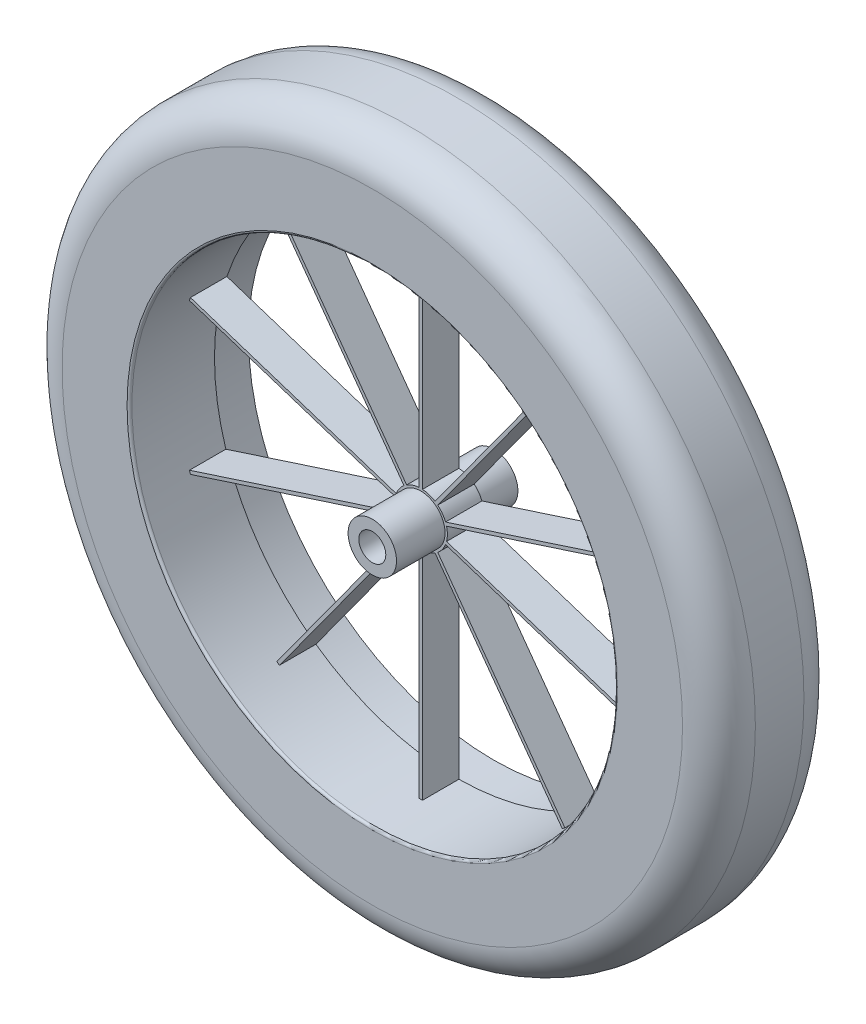
from build123d import *

# Parameters (mm, degrees)
CROQUIS1_R                   = 275
SALIENTE_EXTRUIR1_DEPTH      = 70
CROQUIS2_R                   = 200
CORTAR_EXTRUIR1_DEPTH        = 40
CROQUIS5_R                   = 10
CORTAR_EXTRUIR2_DEPTH        = 10
REDONDEO1_R                  = 2
CORTAR_EXTRUIR_L_MINA2_DEPTH = 396.15819617
MATRIZC1_COUNT               = 24
CORTAR_EXTRUIR3_DEPTH        = 150
SALIENTE_EXTRUIR2_DEPTH      = 50
SALIENTE_EXTRUIR2_DEPTH_BACK = 50
CROQUIS12_R                  = 19.934957438
CROQUIS14_R                  = 285.546784005
CROQUIS14_R_2                = 202
SALIENTE_EXTRUIR3_DEPTH      = 100
REDONDEO2_R                  = 30
REDONDEO3_R                  = 30
SCALE1_SCALE                 = 0.5
SCALE2_SCALE                 = 0.1
SCALE3_SCALE                 = 0.2
SCALE4_SCALE                 = 0.3
SCALE5_SCALE                 = 20
SCALE6_SCALE                 = 1.5
SKETCH1_R                    = 1
CUT_EXTRUDE1_DEPTH           = 5


with BuildPart() as part:
    # Croquis1 → Saliente-Extruir1 (new body)
    with BuildSketch(Plane.XY):
        Circle(CROQUIS1_R)
    extrude(amount=SALIENTE_EXTRUIR1_DEPTH)

    # Croquis2 → Cortar-Extruir1 (cut)
    with BuildSketch(Plane.XY.offset(70)):
        Circle(CROQUIS2_R)
    extrude(amount=-CORTAR_EXTRUIR1_DEPTH, mode=Mode.SUBTRACT)

    # Croquis5 → Cortar-Extruir2 (cut)
    with BuildSketch(Plane.XY.offset(30)):
        Circle(CROQUIS5_R)
    extrude(amount=-CORTAR_EXTRUIR2_DEPTH, mode=Mode.SUBTRACT)

    # Redondeo1
    redondeo1_edges = [part.edges().sort_by_distance(p)[0] for p in [
        (-200, 0, 70),
    ]]
    fillet(redondeo1_edges, radius=REDONDEO1_R)

    # Croquis6 → Cortar-Extruir-Lámina2 (cut, through all)
    with BuildSketch(Plane.XY.offset(70)):
        Polygon((-99.341458201, 256.429863086), (-89.226691548, 230.320640663), (-89.319938771, 230.284516496), (-99.434705424, 256.39373892), align=None)
    cortar_extruir_l_mina2 = extrude(amount=-CORTAR_EXTRUIR_L_MINA2_DEPTH, mode=Mode.SUBTRACT)

    # MatrizC1: Cortar-Extruir-Lámina2 ×24 about axis
    matrizc1_axis = Axis((0, 0, 20), (0, 0, 1))
    for i in range(1, MATRIZC1_COUNT):
        add(cortar_extruir_l_mina2.rotate(matrizc1_axis, i * 360 / MATRIZC1_COUNT), mode=Mode.SUBTRACT)

    # Croquis11 → Cortar-Extruir3 (cut)
    with BuildSketch(Plane.XY.offset(30)):
        with BuildLine():
            Line((20.326023118, 8.014133235), (189.792696605, 63.077193306))
            ThreePointArc((189.792696605, 63.077193306), (161.803398875, 117.557050458), (118.639144382, 161.011656163))
            Line((118.639144382, 161.011656163), (13.902980207, 16.854693372))
            ThreePointArc((13.902980207, 16.854693372), (17.676115044, 12.842449309), (20.326023118, 8.014133235))
        make_face()
        with BuildLine():
            ThreePointArc((190.621360943, -60.526826715), (200, 0), (190.621360943, 60.526826715))
            Line((190.621360943, 60.526826715), (21.154687456, 5.463766645))
            ThreePointArc((21.154687456, 5.463766645), (21.848879772, 0), (21.154687456, -5.463766645))
            Line((21.154687456, -5.463766644), (190.621360943, -60.526826715))
        make_face()
        with BuildLine():
            Line((11.733508805, 18.430906609), (116.469672981, 162.587869399))
            ThreePointArc((116.469672981, 162.587869399), (61.803398875, 190.211303259), (1.340807064, 199.995505541))
            Line((1.340807064, 199.995505541), (1.340807064, 21.807700102))
            ThreePointArc((1.340807064, 21.807700102), (6.751675158, 20.779519481), (11.733508805, 18.430906609))
        make_face()
        with BuildLine():
            ThreePointArc((118.639144382, -161.011656163), (161.803398875, -117.557050458), (189.792696605, -63.077193306))
            Line((189.792696605, -63.077193306), (20.326023118, -8.014133235))
            ThreePointArc((20.326023118, -8.014133235), (17.676115044, -12.842449309), (13.902980207, -16.854693372))
            Line((13.902980207, -16.854693372), (118.639144382, -161.011656163))
        make_face()
        with BuildLine():
            Line((-1.340807064, 21.807700102), (-1.340807064, 199.995505541))
            ThreePointArc((-1.340807064, 199.995505541), (-61.803398875, 190.211303259), (-116.469672981, 162.587869399))
            Line((-116.469672981, 162.587869399), (-11.733508805, 18.430906609))
            ThreePointArc((-11.733508805, 18.430906609), (-6.751675158, 20.779519481), (-1.340807064, 21.807700102))
        make_face()
        with BuildLine():
            ThreePointArc((1.340807064, -199.995505541), (61.803398875, -190.211303259), (116.469672981, -162.587869399))
            Line((116.469672981, -162.587869399), (11.733508805, -18.430906609))
            ThreePointArc((11.733508805, -18.430906609), (6.751675158, -20.779519481), (1.340807064, -21.807700102))
            Line((1.340807064, -21.807700102), (1.340807064, -199.995505541))
        make_face()
        with BuildLine():
            Line((-13.902980207, 16.854693372), (-118.639144382, 161.011656163))
            ThreePointArc((-118.639144382, 161.011656163), (-161.803398875, 117.557050458), (-189.792696605, 63.077193306))
            Line((-189.792696605, 63.077193306), (-20.326023118, 8.014133235))
            ThreePointArc((-20.326023118, 8.014133235), (-17.676115044, 12.842449309), (-13.902980207, 16.854693372))
        make_face()
        with BuildLine():
            ThreePointArc((-116.469672981, -162.587869399), (-61.803398875, -190.211303259), (-1.340807064, -199.995505541))
            Line((-1.340807064, -199.995505541), (-1.340807064, -21.807700102))
            ThreePointArc((-1.340807064, -21.807700102), (-6.751675158, -20.779519481), (-11.733508805, -18.430906609))
            Line((-11.733508805, -18.430906609), (-116.469672981, -162.587869399))
        make_face()
        with BuildLine():
            Line((-21.154687456, 5.463766645), (-190.621360943, 60.526826715))
            ThreePointArc((-190.621360943, 60.526826715), (-200, 0), (-190.621360943, -60.526826715))
            Line((-190.621360943, -60.526826715), (-21.154687456, -5.463766644))
            ThreePointArc((-21.154687456, -5.463766644), (-21.848879772, 0), (-21.154687456, 5.463766645))
        make_face()
        with BuildLine():
            ThreePointArc((-189.792696605, -63.077193306), (-161.803398875, -117.557050458), (-118.639144382, -161.011656163))
            Line((-118.639144382, -161.011656163), (-13.902980207, -16.854693372))
            ThreePointArc((-13.902980207, -16.854693372), (-17.676115044, -12.842449309), (-20.326023118, -8.014133235))
            Line((-20.326023118, -8.014133235), (-189.792696605, -63.077193306))
        make_face()
    extrude(amount=-CORTAR_EXTRUIR3_DEPTH, mode=Mode.SUBTRACT)

    # Croquis12 → Saliente-Extruir2 (add, two sides: drawn at the far end of the back side and taken through both)
    with BuildSketch(Plane.XY.offset(20).offset(-SALIENTE_EXTRUIR2_DEPTH_BACK)):
        Circle(CROQUIS12_R)
    extrude(amount=SALIENTE_EXTRUIR2_DEPTH + SALIENTE_EXTRUIR2_DEPTH_BACK)

    # Croquis14 → Saliente-Extruir3 (add)
    with BuildSketch(Plane.XY.offset(70)):
        Circle(CROQUIS14_R)
        Circle(CROQUIS14_R_2, mode=Mode.SUBTRACT)
    extrude(amount=-SALIENTE_EXTRUIR3_DEPTH)

    # Redondeo2
    redondeo2_edges = [part.edges().sort_by_distance(p)[0] for p in [
        (-285.546784005, 0, 70),
    ]]
    fillet(redondeo2_edges, radius=REDONDEO2_R)

    # Redondeo3
    redondeo3_edges = [part.edges().sort_by_distance(p)[0] for p in [
        (-285.546784005, 0, -30),
    ]]
    fillet(redondeo3_edges, radius=REDONDEO3_R)


with BuildPart() as part_1:
    # Scale1: scaled about (0, 0, 20.146701312)
    add(part.part.scale(SCALE1_SCALE).moved(Location((0, 0, 10.073350656))))


with BuildPart() as part_2:
    # Scale2: scaled about (0, 0, 20.146701312)
    add(part_1.part.scale(SCALE2_SCALE).moved(Location((0, 0, 18.132031181))))


with BuildPart() as part_3:
    # Scale3: scaled about (0, 0, 20.146701312)
    add(part_2.part.scale(SCALE3_SCALE).moved(Location((0, 0, 16.11736105))))


with BuildPart() as part_4:
    # Scale4: scaled about (0, 0, 20.146701312)
    add(part_3.part.scale(SCALE4_SCALE).moved(Location((0, 0, 14.102690918))))


with BuildPart() as part_5:
    # Scale5: scaled about (0, 0, 20.146701312)
    add(part_4.part.scale(SCALE5_SCALE).moved(Location((0, 0, -382.787324928))))


with BuildPart() as part_6:
    # Scale6: scaled about (0, 0, 20.146701312)
    add(part_5.part.scale(SCALE6_SCALE).moved(Location((0, 0, -10.073350656))))

    # Sketch1 → Cut-Extrude1 (cut)
    with BuildSketch(Plane.XY.offset(24.633498194)):
        Circle(SKETCH1_R)
    extrude(amount=-CUT_EXTRUDE1_DEPTH, mode=Mode.SUBTRACT)


solid = part_6.part
